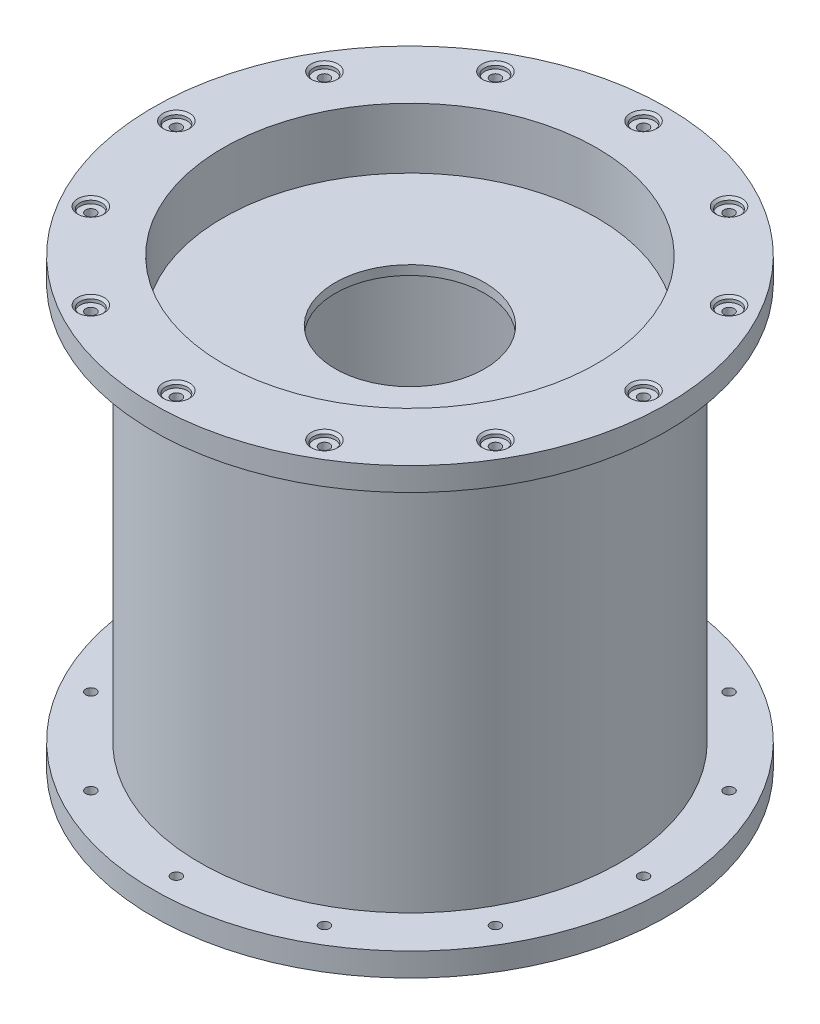
from build123d import *

# Parameters (mm, degrees)
SKETCH4_W                                    = 30.48
SKETCH4_H                                    = 2.54
CBORE_FOR_3_BINDING_HEAD_MACHINE_SC_2_COUNT  = 2
CBORE_FOR_3_BINDING_HEAD_MACHINE_SC_2_PITCH  = 63.5
CBORE_FOR_3_BINDING_HEAD_MACHINE_SC_3_COUNT  = 2
CBORE_FOR_3_BINDING_HEAD_MACHINE_SC_3_PITCH  = 32.870018728
CBORE_FOR_3_BINDING_HEAD_MACHINE_SC_4_COUNT  = 2
CBORE_FOR_3_BINDING_HEAD_MACHINE_SC_4_PITCH  = 63.5
CBORE_FOR_3_BINDING_HEAD_MACHINE_SC_5_COUNT  = 2
CBORE_FOR_3_BINDING_HEAD_MACHINE_SC_5_PITCH  = 89.802561211
CBORE_FOR_3_BINDING_HEAD_MACHINE_SC_6_COUNT  = 2
CBORE_FOR_3_BINDING_HEAD_MACHINE_SC_6_PITCH  = 109.985226281
CBORE_FOR_3_BINDING_HEAD_MACHINE_SC_7_COUNT  = 2
CBORE_FOR_3_BINDING_HEAD_MACHINE_SC_7_PITCH  = 122.672579939
CBORE_FOR_3_BINDING_HEAD_MACHINE_SC_8_COUNT  = 2
CBORE_FOR_3_BINDING_HEAD_MACHINE_SC_8_PITCH  = 127
CBORE_FOR_3_BINDING_HEAD_MACHINE_SC_9_COUNT  = 2
CBORE_FOR_3_BINDING_HEAD_MACHINE_SC_9_PITCH  = 122.672579939
CBORE_FOR_3_BINDING_HEAD_MACHINE_SC_10_COUNT = 2
CBORE_FOR_3_BINDING_HEAD_MACHINE_SC_10_PITCH = 109.985226281
CBORE_FOR_3_BINDING_HEAD_MACHINE_SC_11_COUNT = 2
CBORE_FOR_3_BINDING_HEAD_MACHINE_SC_11_PITCH = 89.802561211
CBORE_FOR_3_BINDING_HEAD_MACHINE_SC_12_COUNT = 2
CBORE_FOR_3_BINDING_HEAD_MACHINE_SC_12_PITCH = 63.5
CBORE_FOR_3_BINDING_HEAD_MACHINE_SC_13_COUNT = 2
CBORE_FOR_3_BINDING_HEAD_MACHINE_SC_13_PITCH = 32.870018728


with BuildPart() as part:
    # Sketch1 → Chamber (revolve)
    with BuildSketch(Plane(origin=(0, 0, 0), x_dir=(0, 0, -1), z_dir=(1, 0, 0))):
        Polygon((57.15, 6.35), (57.15, 114.3), (69.85, 114.3), (69.85, 120.65), (57.15, 120.65), (50.8, 120.65), (50.8, 114.3), (50.8, 6.35), (50.8, 0), (57.15, 0), (69.85, 0), (69.85, 6.35), align=None)
    revolve(axis=Axis((0, 0, 0), (0, 1, 0)))

    # Sketch4 → Turbulence Rings (revolve)
    with BuildSketch(Plane(origin=(0, 0, 0), x_dir=(0, 0, -1), z_dir=(1, 0, 0))):
        with Locations((35.56, 102.931657822)):
            Rectangle(SKETCH4_W, SKETCH4_H)
        with Locations((35.56, 17.718342178)):
            Rectangle(SKETCH4_W, SKETCH4_H)
    revolve(axis=Axis((0, 0, 0), (0, 1, 0)))

    # Sketch9 → CBORE for #3 Binding Head Machine Screw2 (revolve, cut)
    with BuildSketch(Plane(origin=(-54.99261314, 120.65, 31.75), x_dir=(0, 0, 1), z_dir=(1, 0, 0))):
        Polygon((0, 0), (0, 120.65), (3.61188, 120.65), (1.397, 118.43512), (1.397, 1.4986), (2.97688, 1.4986), (2.97688, 0.635), (3.61188, 0), align=None)
    cbore_for_3_binding_head_machine_screw2 = revolve(axis=Axis((-54.99261314, 127, 31.75), (0, -1, 0)), mode=Mode.SUBTRACT)

    # CBORE for _3 Binding Head Machine Sc 2: CBORE for #3 Binding Head Machine Screw2 ×2
    with Locations(*[Vector(0.8660254037844387, 0, -0.5) * (i * CBORE_FOR_3_BINDING_HEAD_MACHINE_SC_2_PITCH) for i in range(1, CBORE_FOR_3_BINDING_HEAD_MACHINE_SC_2_COUNT)]):
        add(cbore_for_3_binding_head_machine_screw2, mode=Mode.SUBTRACT)

    # CBORE for _3 Binding Head Machine Sc 3: CBORE for #3 Binding Head Machine Screw2 ×2
    with Locations(*[Vector(-0.25881904510252096, 0, -0.9659258262890682) * (i * CBORE_FOR_3_BINDING_HEAD_MACHINE_SC_3_PITCH) for i in range(1, CBORE_FOR_3_BINDING_HEAD_MACHINE_SC_3_COUNT)]):
        add(cbore_for_3_binding_head_machine_screw2, mode=Mode.SUBTRACT)

    # CBORE for _3 Binding Head Machine Sc 4: CBORE for #3 Binding Head Machine Screw2 ×2
    with Locations(*[(0, 0, -i * CBORE_FOR_3_BINDING_HEAD_MACHINE_SC_4_PITCH) for i in range(1, CBORE_FOR_3_BINDING_HEAD_MACHINE_SC_4_COUNT)]):
        add(cbore_for_3_binding_head_machine_screw2, mode=Mode.SUBTRACT)

    # CBORE for _3 Binding Head Machine Sc 5: CBORE for #3 Binding Head Machine Screw2 ×2
    with Locations(*[Vector(0.2588190451025207, 0, -0.9659258262890683) * (i * CBORE_FOR_3_BINDING_HEAD_MACHINE_SC_5_PITCH) for i in range(1, CBORE_FOR_3_BINDING_HEAD_MACHINE_SC_5_COUNT)]):
        add(cbore_for_3_binding_head_machine_screw2, mode=Mode.SUBTRACT)

    # CBORE for _3 Binding Head Machine Sc 6: CBORE for #3 Binding Head Machine Screw2 ×2
    with Locations(*[Vector(0.5, 0, -0.8660254037844387) * (i * CBORE_FOR_3_BINDING_HEAD_MACHINE_SC_6_PITCH) for i in range(1, CBORE_FOR_3_BINDING_HEAD_MACHINE_SC_6_COUNT)]):
        add(cbore_for_3_binding_head_machine_screw2, mode=Mode.SUBTRACT)

    # CBORE for _3 Binding Head Machine Sc 7: CBORE for #3 Binding Head Machine Screw2 ×2
    with Locations(*[Vector(0.7071067811865475, 0, -0.7071067811865476) * (i * CBORE_FOR_3_BINDING_HEAD_MACHINE_SC_7_PITCH) for i in range(1, CBORE_FOR_3_BINDING_HEAD_MACHINE_SC_7_COUNT)]):
        add(cbore_for_3_binding_head_machine_screw2, mode=Mode.SUBTRACT)

    # CBORE for _3 Binding Head Machine Sc 8: CBORE for #3 Binding Head Machine Screw2 ×2
    with Locations(*[Vector(0.8660254037844386, 0, -0.5000000000000001) * (i * CBORE_FOR_3_BINDING_HEAD_MACHINE_SC_8_PITCH) for i in range(1, CBORE_FOR_3_BINDING_HEAD_MACHINE_SC_8_COUNT)]):
        add(cbore_for_3_binding_head_machine_screw2, mode=Mode.SUBTRACT)

    # CBORE for _3 Binding Head Machine Sc 9: CBORE for #3 Binding Head Machine Screw2 ×2
    with Locations(*[Vector(0.9659258262890683, 0, -0.25881904510252074) * (i * CBORE_FOR_3_BINDING_HEAD_MACHINE_SC_9_PITCH) for i in range(1, CBORE_FOR_3_BINDING_HEAD_MACHINE_SC_9_COUNT)]):
        add(cbore_for_3_binding_head_machine_screw2, mode=Mode.SUBTRACT)

    # CBORE for _3 Binding Head Machine Sc 10: CBORE for #3 Binding Head Machine Screw2 ×2
    with Locations(*[(i * CBORE_FOR_3_BINDING_HEAD_MACHINE_SC_10_PITCH, 0, 0) for i in range(1, CBORE_FOR_3_BINDING_HEAD_MACHINE_SC_10_COUNT)]):
        add(cbore_for_3_binding_head_machine_screw2, mode=Mode.SUBTRACT)

    # CBORE for _3 Binding Head Machine Sc 11: CBORE for #3 Binding Head Machine Screw2 ×2
    with Locations(*[Vector(0.9659258262890683, 0, 0.25881904510252074) * (i * CBORE_FOR_3_BINDING_HEAD_MACHINE_SC_11_PITCH) for i in range(1, CBORE_FOR_3_BINDING_HEAD_MACHINE_SC_11_COUNT)]):
        add(cbore_for_3_binding_head_machine_screw2, mode=Mode.SUBTRACT)

    # CBORE for _3 Binding Head Machine Sc 12: CBORE for #3 Binding Head Machine Screw2 ×2
    with Locations(*[Vector(0.8660254037844386, 0, 0.5000000000000001) * (i * CBORE_FOR_3_BINDING_HEAD_MACHINE_SC_12_PITCH) for i in range(1, CBORE_FOR_3_BINDING_HEAD_MACHINE_SC_12_COUNT)]):
        add(cbore_for_3_binding_head_machine_screw2, mode=Mode.SUBTRACT)

    # CBORE for _3 Binding Head Machine Sc 13: CBORE for #3 Binding Head Machine Screw2 ×2
    with Locations(*[Vector(0.7071067811865477, 0, 0.7071067811865475) * (i * CBORE_FOR_3_BINDING_HEAD_MACHINE_SC_13_PITCH) for i in range(1, CBORE_FOR_3_BINDING_HEAD_MACHINE_SC_13_COUNT)]):
        add(cbore_for_3_binding_head_machine_screw2, mode=Mode.SUBTRACT)


solid = part.part
